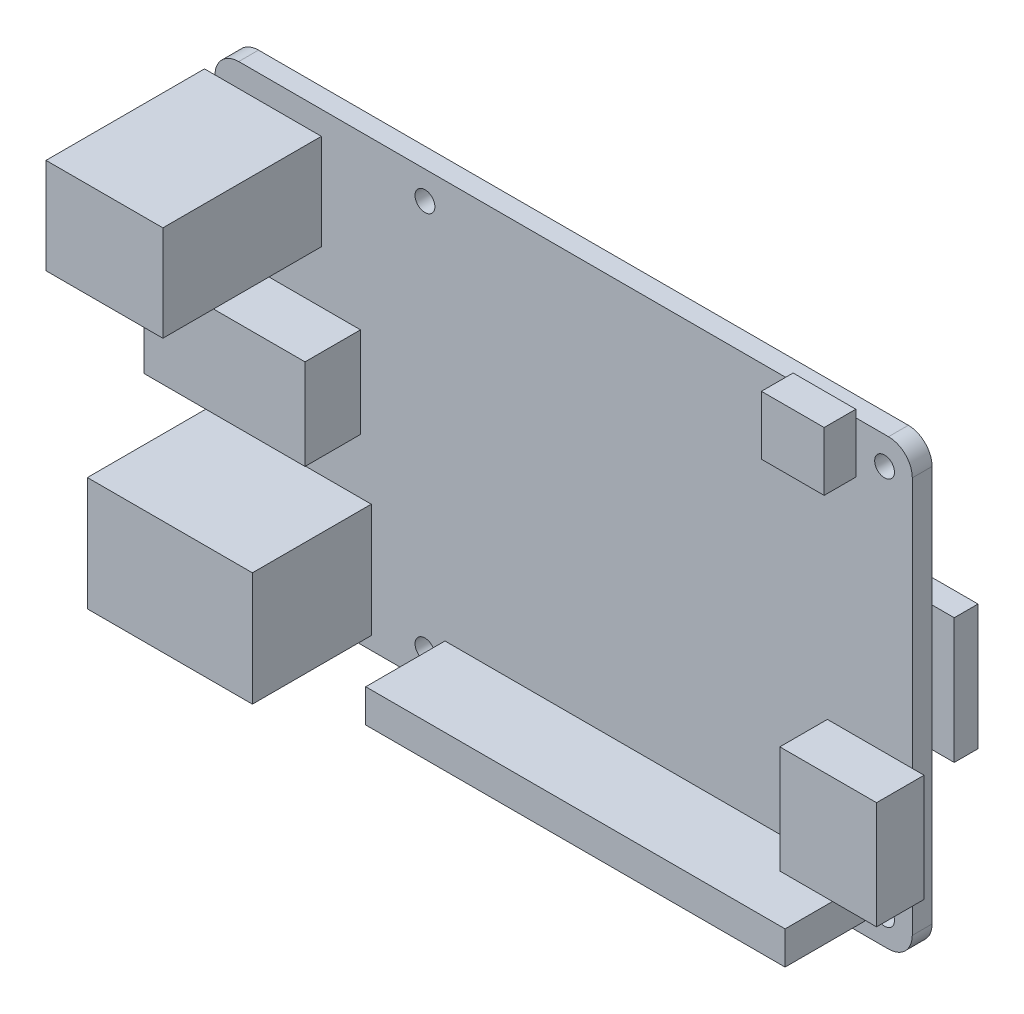
from build123d import *

# Parameters (mm, degrees)
SKETCH_1_W      = 88
SKETCH_1_H      = 56
SKETCH_1_R      = 1.25
EXTRUDE_1_DEPTH = 2.5
SKETCH_3_W      = 14.749474834
SKETCH_3_H      = 12.067752137
EXTRUDE_2_DEPTH = 20
SKETCH_4_W      = 20.823165918
SKETCH_4_H      = 14.358457545
EXTRUDE_3_DEPTH = 15
SKETCH_5_W      = 20.346818985
SKETCH_5_H      = 11.432326386
EXTRUDE_4_DEPTH = 7
SKETCH_6_W      = 52.92270657
SKETCH_6_H      = 4.181716452
EXTRUDE_5_DEPTH = 10
SKETCH_7_W      = 12.202385712
SKETCH_7_H      = 13.573440286
EXTRUDE_6_DEPTH = 6
SKETCH_8_W      = 24.111474105
SKETCH_8_H      = 15.818799485
EXTRUDE_7_DEPTH = 3
SKETCH_9_W      = 7.916095885
SKETCH_9_H      = 7.421339892
EXTRUDE_8_DEPTH = 4
FILLET_1_R      = 3


with BuildPart() as part:
    # 草图1 → 凸台-拉伸1 (new body)
    with BuildSketch(Plane.XY):
        Rectangle(SKETCH_1_W, SKETCH_1_H)
        with Locations((-17.5, 24.5)):
            Circle(SKETCH_1_R, mode=Mode.SUBTRACT)
        with Locations((40.5, 24.5)):
            Circle(SKETCH_1_R, mode=Mode.SUBTRACT)
        with Locations((40.5, -24.5)):
            Circle(SKETCH_1_R, mode=Mode.SUBTRACT)
        with Locations((-17.5, -24.5)):
            Circle(SKETCH_1_R, mode=Mode.SUBTRACT)
    extrude(amount=EXTRUDE_1_DEPTH)

    # 草图3 → 凸台-拉伸2 (add)
    with BuildSketch(Plane.XY.offset(2.5)):
        with Locations((-37.946376164, 19.006709616)):
            Rectangle(SKETCH_3_W, SKETCH_3_H)
    extrude(amount=EXTRUDE_2_DEPTH)

    # 草图4 → 凸台-拉伸3 (add)
    with BuildSketch(Plane.XY.offset(2.5)):
        with Locations((-34.685337702, -19.189976435)):
            Rectangle(SKETCH_4_W, SKETCH_4_H)
    extrude(amount=EXTRUDE_3_DEPTH)

    # 草图5 → 凸台-拉伸4 (add)
    with BuildSketch(Plane.XY.offset(2.5)):
        with Locations((-35.808155473, 0.646470837)):
            Rectangle(SKETCH_5_W, SKETCH_5_H)
    extrude(amount=EXTRUDE_4_DEPTH)

    # 草图6 → 凸台-拉伸5 (add)
    with BuildSketch(Plane.XY.offset(2.5)):
        with Locations((11.485814144, -24.404771423)):
            Rectangle(SKETCH_6_W, SKETCH_6_H)
    extrude(amount=EXTRUDE_5_DEPTH)

    # 草图7 → 凸台-拉伸6 (add)
    with BuildSketch(Plane.XY.offset(2.5)):
        with Locations((39.386774732, -13.539163922)):
            Rectangle(SKETCH_7_W, SKETCH_7_H)
    extrude(amount=EXTRUDE_6_DEPTH)

    # 草图8 → 凸台-拉伸7 (add)
    with BuildSketch(Plane(origin=(0, 0, 0), x_dir=(-1, 0, 0), z_dir=(0, 0, -1))):
        with Locations((-34.735744668, 1.951217558)):
            Rectangle(SKETCH_8_W, SKETCH_8_H)
    extrude(amount=EXTRUDE_7_DEPTH)

    # 草图9 → 凸台-拉伸8 (add)
    with BuildSketch(Plane.XY.offset(2.5)):
        with Locations((32.917495051, 25.232555635)):
            Rectangle(SKETCH_9_W, SKETCH_9_H)
    extrude(amount=EXTRUDE_8_DEPTH)

    # 圆角1
    # the kernel refuses this fillet: 3 mm, written as the material it takes off along each edge
    with BuildSketch(Plane(origin=(44, -28, -7.5), x_dir=(-1, 0, 0), z_dir=(0, 0, 1)), Plane(origin=(44, 28, -7.5), x_dir=(0, -1, 0), z_dir=(0, 0, 1))) as fillet_1_piece_1:
        with BuildLine():
            CenterArc((FILLET_1_R, -FILLET_1_R), FILLET_1_R, 90, 90)
            Line((0, -FILLET_1_R), (0, 0))
            Line((0, 0), (FILLET_1_R, 0))
        make_face()
    extrude(amount=17.5, mode=Mode.SUBTRACT)
    with BuildSketch(Plane(origin=(-44, -28, -7.5), x_dir=(1, 0, 0), z_dir=(0, 0, 1)), Plane(origin=(-44, 28, -7.5), x_dir=(0, -1, 0), z_dir=(0, 0, 1))) as fillet_1_piece_2:
        with BuildLine():
            CenterArc((FILLET_1_R, FILLET_1_R), FILLET_1_R, 180, 90)
            Line((0, FILLET_1_R), (0, 0))
            Line((0, 0), (FILLET_1_R, 0))
        make_face()
    extrude(amount=10, mode=Mode.SUBTRACT)


solid = part.part
